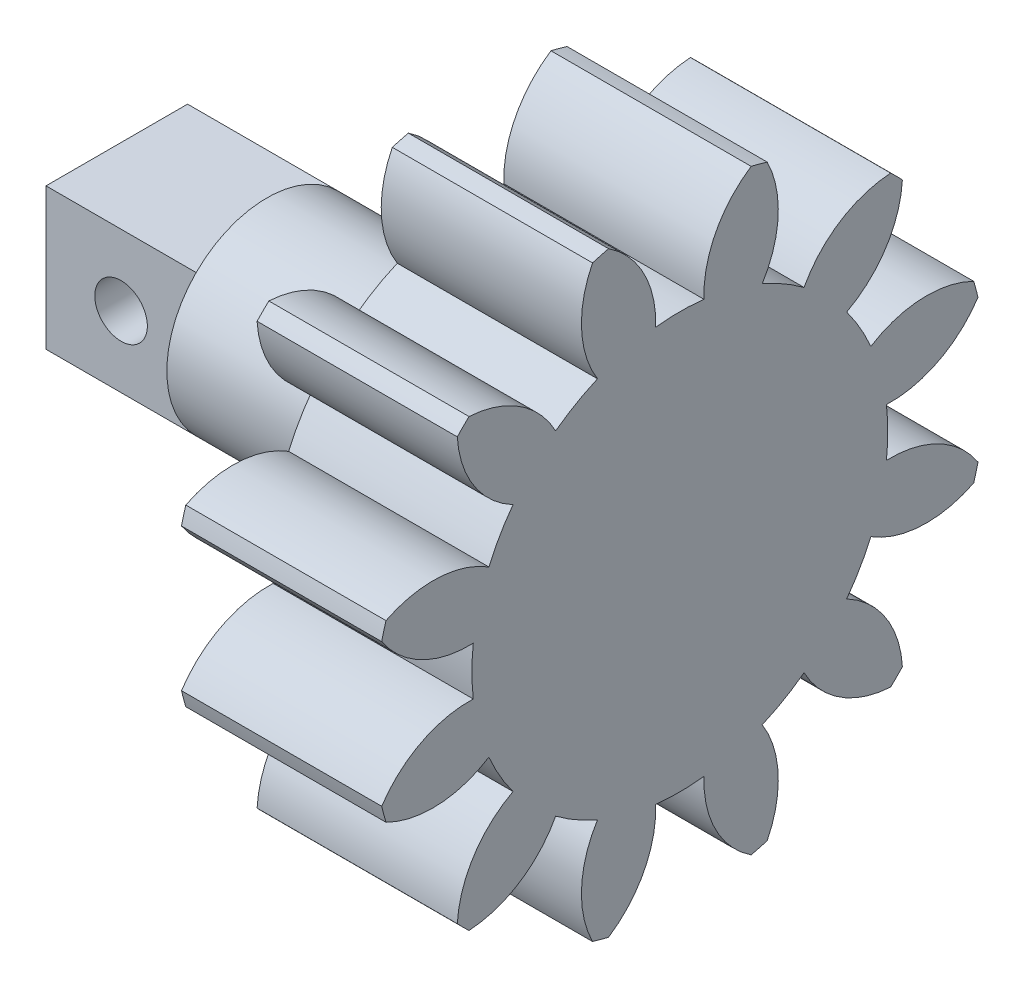
from build123d import *

# Parameters (mm, degrees)
BASPROSKE_W             = 10
BASPROSKE_H             = 12.25
TOOTHCUT_DEPTH          = 21.003124756
TEETHCUTS_COUNT         = 12
TEETHCUTS_ANGLE         = 330
BORSKE_R                = 4.5
BORE_DEPTH              = 50.0000508
ESQUISSE4_R             = 16.84973796
ENL_V_MAT_EXTRU_2_DEPTH = 2
ESQUISSE5_R             = 5.070841349
BOSS_EXTRU_7_DEPTH      = 8
ESQUISSE6_R             = 4
BOSS_EXTRU_8_DEPTH      = 8.5
ESQUISSE7_W             = 5.65685425
ESQUISSE7_H             = 5.65685425
BOSS_EXTRU_9_DEPTH      = 6
ESQUISSE8_R             = 1.05
ENL_V_MAT_EXTRU_3_DEPTH = 6


with BuildPart() as part:
    # BasProSke → Base-Revolve (revolve)
    with BuildSketch(Plane(origin=(0, 0, 0), x_dir=(1, 0, 0), z_dir=(0, 1, 0))):
        with Locations((5, 6.125)):
            Rectangle(BASPROSKE_W, BASPROSKE_H)
    revolve(axis=Axis((-10, 0, 0), (1, 0, 0)))

    # TooCutSke → ToothCut (cut, through all)
    with BuildSketch(Plane(origin=(0, 0, 0), x_dir=(0, 0, -1), z_dir=(1, 0, 0))):
        with BuildLine():
            ThreePointArc((0.965128363, 8.255274647), (0, 8.3115), (-0.965128363, 8.255274647))
            ThreePointArc((-0.965128363, 8.255274647), (-1.43628674, 10.346733197), (-2.878284339, 11.933185846))
            ThreePointArc((-2.878284339, 11.933185846), (0, 12.2754), (2.878284339, 11.933185846))
            ThreePointArc((2.878284339, 11.933185846), (1.43628674, 10.346733197), (0.965128363, 8.255274647))
        make_face()
    toothcut = extrude(amount=TOOTHCUT_DEPTH, mode=Mode.SUBTRACT)

    # TeethCuts: ToothCut ×12 about axis
    teethcuts_axis = Axis((-10, 0, 0), (1, 0, 0))
    for i in range(1, TEETHCUTS_COUNT):
        add(toothcut.rotate(teethcuts_axis, i * TEETHCUTS_ANGLE / (TEETHCUTS_COUNT - 1)), mode=Mode.SUBTRACT)

    # BorSke → Bore (cut, symmetric)
    with BuildSketch(Plane(origin=(0, 0, 0), x_dir=(0, 0, -1), z_dir=(1, 0, 0))):
        Circle(BORSKE_R)
    extrude(amount=BORE_DEPTH, both=True, mode=Mode.SUBTRACT)

    # Esquisse4 → Enlèv. mat.-Extru.2 (cut)
    with BuildSketch(Plane.ZY):
        Circle(ESQUISSE4_R)
    extrude(amount=-ENL_V_MAT_EXTRU_2_DEPTH, mode=Mode.SUBTRACT)

    # Esquisse5 → Boss.-Extru.7 (add)
    with BuildSketch(Plane.ZY.offset(-2)):
        Circle(ESQUISSE5_R)
    extrude(amount=-BOSS_EXTRU_7_DEPTH)

    # Esquisse6 → Boss.-Extru.8 (add)
    with BuildSketch(Plane.ZY.offset(-2)):
        Circle(ESQUISSE6_R)
    extrude(amount=BOSS_EXTRU_8_DEPTH)

    # Esquisse7 → Boss.-Extru.9 (add)
    with BuildSketch(Plane.ZY.offset(6.5)):
        Rectangle(ESQUISSE7_W, ESQUISSE7_H)
    extrude(amount=BOSS_EXTRU_9_DEPTH)

    # Esquisse8 → Enlèv. mat.-Extru.3 (cut)
    with BuildSketch(Plane(origin=(0, 0, -2.828427125), x_dir=(-1, 0, 0), z_dir=(0, 0, -1))):
        with Locations((9.5, 0)):
            Circle(ESQUISSE8_R)
    extrude(amount=-ENL_V_MAT_EXTRU_3_DEPTH, mode=Mode.SUBTRACT)


solid = part.part
